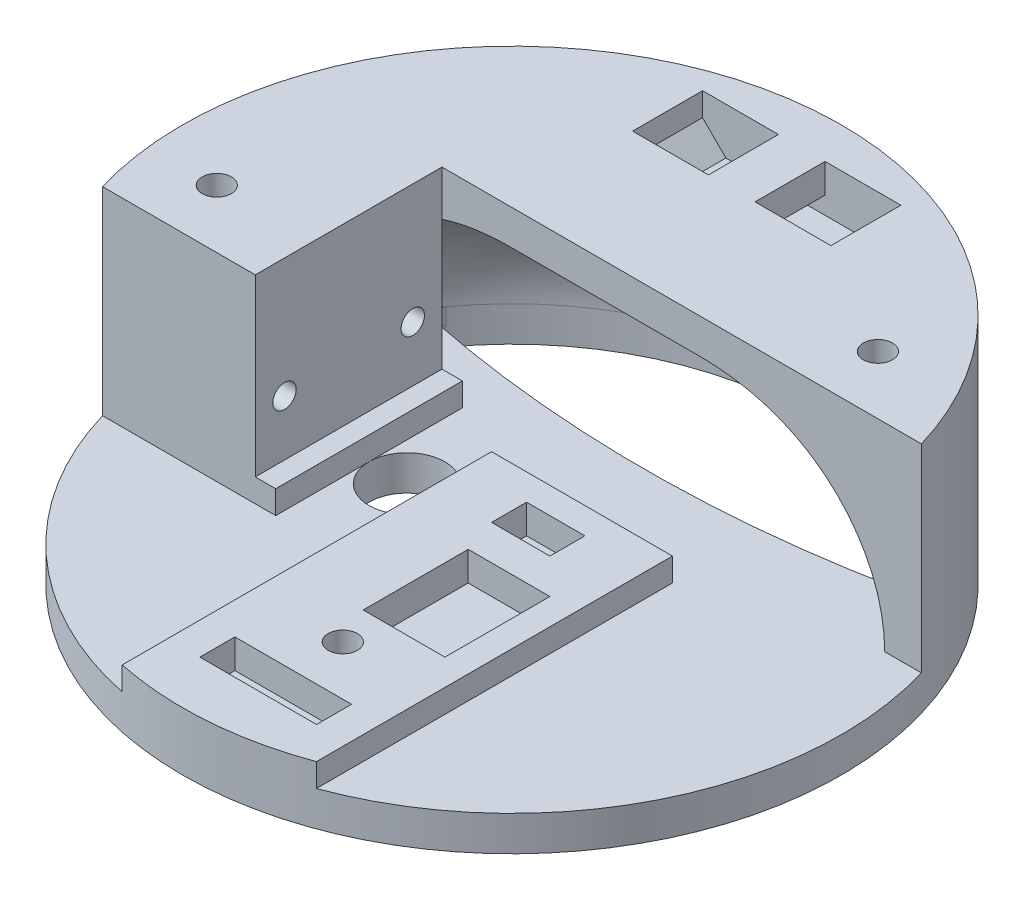
from build123d import *
from build123d.topology import SkipClean

# Parameters (mm, degrees)
SKETCH1_R               = 28.25
BOSS_EXTRUDE1_DEPTH     = 3
SKETCH2_R               = 3.25
CUT_EXTRUDE1_DEPTH      = 41.064011282
CUT_EXTRUDE2_DEPTH      = 41.064011282
REVOLVE1_ANGLE          = 180
BOSS_EXTRUDE2_DEPTH     = 17
CHAMFER2_SIZE           = 2
CUT_EXTRUDE5_DEPTH      = 54.275815376
CUT_EXTRUDE5_DEPTH_BACK = 1.75
SKETCH9_W               = 16
SKETCH9_H               = 15
CUT_EXTRUDE11_REACH     = 45.418
BOSS_EXTRUDE6_START     = -3
BOSS_EXTRUDE6_DEPTH     = 3
SKETCH17_R              = 1
CUT_EXTRUDE12_DEPTH     = 6
BOSS_EXTRUDE5_DEPTH     = 2
SKETCH13_R              = 1.25
CUT_EXTRUDE8_DEPTH      = 4
SKETCH14_W              = 10
SKETCH14_H              = 3
SKETCH14_W_2            = 5
SKETCH14_W_3            = 7
SKETCH14_H_2            = 9
CUT_EXTRUDE9_DEPTH      = 2.5
FILLET40_R              = 1
SKETCH18_R              = 1.25
CUT_EXTRUDE13_DEPTH     = 5
SKETCH19_W              = 6.5
SKETCH19_H              = 6
CUT_EXTRUDE14_DEPTH     = 4
SKETCH20_W              = 6
SKETCH20_H              = 1.5
CUT_EXTRUDE15_DEPTH     = 4
CHAMFER3_SIZE           = 2


# Read off the part's stored shape, not the designer's step: Revolve1
with BuildPart() as part:
    # Sketch1 → Boss-Extrude1 (new body)
    with BuildSketch(Plane(origin=(0, 0, 0), x_dir=(1, 0, 0), z_dir=(0, 1, 0))):
        with Locations(Location((0, 0, 0), (0, 0, 270))):
            Circle(SKETCH1_R)
    extrude(amount=BOSS_EXTRUDE1_DEPTH)

    # Sketch2 → Cut-Extrude1 (cut, through all)
    with BuildSketch(Plane(origin=(0, 3, 0), x_dir=(1, 0, 0), z_dir=(0, 1, 0))):
        with Locations(Location((-9, 0, 0), (0, 0, 270))):
            Circle(SKETCH2_R)
    extrude(amount=-CUT_EXTRUDE1_DEPTH, mode=Mode.SUBTRACT)

    # Sketch3 → Cut-Extrude2 (cut, through all)
    with BuildSketch(Plane(origin=(0, 3, 0), x_dir=(1, 0, 0), z_dir=(0, 1, 0))):
        with BuildLine():
            ThreePointArc((21.3084804, 13.546629213), (0, 25.25), (-21.3084804, 13.546629213))
            ThreePointArc((-21.3084804, 13.546629213), (0, 11.25), (21.3084804, 13.546629213))
        make_face()
    extrude(amount=-CUT_EXTRUDE2_DEPTH, mode=Mode.SUBTRACT)

    # Revolve1 outline → Revolve1 (revolve)
    with SkipClean():  # the faces are left unmerged after this step: merging them gives an invalid solid
        with BuildSketch(Plane.XY):
            with BuildLine():
                Line((28.25, 3), (28.25, 20))
                Line((28.25, 20), (11.25, 20))
                Line((11.25, 20), (11.25, 17))
                ThreePointArc((11.25, 17), (21.149494937, 12.899494937), (25.25, 3))
                Line((25.25, 3), (28.25, 3))
            make_face()
        revolve(axis=Axis((0, 0, 0), (0, 1, 0)), revolution_arc=REVOLVE1_ANGLE)
    add(part.part.scale(1), mode=Mode.REPLACE)  # the faces are merged on a copy

    # Sketch5 → Boss-Extrude2 (add)
    with BuildSketch(Plane(origin=(0, 3, 0), x_dir=(1, 0, 0), z_dir=(0, 1, 0))):
        with BuildLine():
            Line((-27.093587802, 8), (-12.25, 8))
            Line((-12.25, 8), (-12.25, -8))
            Line((-12.25, -8), (-27.093587802, -8))
            ThreePointArc((-27.093587802, -8), (-27.959402313, -4.041574234), (-28.25, 0))
            ThreePointArc((-28.25, 0), (-27.959402313, 4.041574234), (-27.093587802, 8))
        make_face()
    extrude(amount=BOSS_EXTRUDE2_DEPTH)

    # Chamfer2
    chamfer2_edges = [part.edges().sort_by_distance(p)[0] for p in [
        (0, 0, -11.25),
    ]]
    chamfer(chamfer2_edges, length=CHAMFER2_SIZE)

    # Sketch9 → Cut-Extrude5 (cut, two sides: drawn at the far end of the back side and taken through both)
    with BuildSketch(Plane(origin=(-12.25, 0, 0), x_dir=(0, 0, -1), z_dir=(1, 0, 0)).offset(-CUT_EXTRUDE5_DEPTH_BACK)):
        with Locations((0, 12.5)):
            Rectangle(SKETCH9_W, SKETCH9_H)
    extrude(amount=CUT_EXTRUDE5_DEPTH + CUT_EXTRUDE5_DEPTH_BACK, mode=Mode.SUBTRACT)

    # Sketch15 → Cut-Extrude11 (cut, up to next)
    with BuildSketch(Plane(origin=(0, 3, 0), x_dir=(1, 0, 0), z_dir=(0, 1, 0)), mode=Mode.PRIVATE) as cut_extrude11_sk1:
        with BuildLine():
            Line((25.106406461, 0), (28.25, 0))
            ThreePointArc((28.25, 0), (27.959402313, 4.041574234), (27.093587802, 8))
            Line((27.093587802, 8), (23.797723533, 8))
            ThreePointArc((23.797723533, 8), (24.777075748, 4.053167003), (25.106406461, 0))
        make_face()
    cut_extrude11_tool1 = extrude(cut_extrude11_sk1.sketch, amount=CUT_EXTRUDE11_REACH, mode=Mode.PRIVATE) & part.part
    add(cut_extrude11_tool1.solids().sort_by_distance((26.266134, 3, -4.03133))[0], mode=Mode.SUBTRACT)

    # Sketch16 → Boss-Extrude6 (add)
    with BuildSketch(Plane(origin=(0, 20, 0), x_dir=(1, 0, 0), z_dir=(0, 1, 0)).offset(BOSS_EXTRUDE6_START)):
        with BuildLine():
            Line((-7.90964601, 8), (7.90964601, 8))
            ThreePointArc((7.90964601, 8), (0, 11.25), (-7.90964601, 8))
        make_face()
    extrude(amount=BOSS_EXTRUDE6_DEPTH)

    # Sketch17 → Cut-Extrude12 (cut)
    with BuildSketch(Plane(origin=(-14, 0, 0), x_dir=(0, 0, -1), z_dir=(1, 0, 0))):
        with Locations((-5.5, 9.75)):
            Circle(SKETCH17_R)
        with Locations(Location((5.5, 9.75, 0), (0, 0, 180))):
            Circle(SKETCH17_R)
    extrude(amount=-CUT_EXTRUDE12_DEPTH, mode=Mode.SUBTRACT)

    # Sketch12 → Boss-Extrude5 (add)
    with BuildSketch(Plane(origin=(0, 3, 0), x_dir=(1, 0, 0), z_dir=(0, 1, 0))):
        with BuildLine():
            Line((-5.75, 4), (9.75, 4))
            Line((9.75, 4), (9.75, -26.514147167))
            ThreePointArc((9.75, -26.514147167), (2.080255313, -28.173303637), (-5.75, -27.658633372))
            Line((-5.75, -27.658633372), (-5.75, 4))
        make_face()
    extrude(amount=BOSS_EXTRUDE5_DEPTH)

    # Sketch13 → Cut-Extrude8 (cut)
    with BuildSketch(Plane(origin=(0, 5, 0), x_dir=(1, 0, 0), z_dir=(0, 1, 0))):
        with Locations(Location((2, -16.5, 0), (0, 0, 270))):
            Circle(SKETCH13_R)
    extrude(amount=-CUT_EXTRUDE8_DEPTH, mode=Mode.SUBTRACT)

    # Sketch14 → Cut-Extrude9 (cut)
    with BuildSketch(Plane(origin=(0, 5, 0), x_dir=(1, 0, 0), z_dir=(0, 1, 0))):
        with Locations((2, -22.25)):
            Rectangle(SKETCH14_W, SKETCH14_H)
        with Locations((2, 0.25)):
            Rectangle(SKETCH14_W_2, SKETCH14_H)
        with Locations((4, -8.75)):
            Rectangle(SKETCH14_W_3, SKETCH14_H_2)
    extrude(amount=-CUT_EXTRUDE9_DEPTH, mode=Mode.SUBTRACT)

    # Fillet40
    fillet40_edges = [part.edges().sort_by_distance(p)[0] for p in [
        (21.3084804, 2.5, -13.546629213),
        (-21.3084804, 2.5, -13.546629213),
        (21.854641388, 1.003709428, -12.646626025),
        (-21.854641386, 1.003709427, -12.646626025),
    ]]
    fillet(fillet40_edges, radius=FILLET40_R)

    # Sketch18 → Cut-Extrude13 (cut)
    with BuildSketch(Plane(origin=(0, 20, 0), x_dir=(1, 0, 0), z_dir=(0, 1, 0))):
        with Locations(Location((-22.299103121, -3, 0), (0, 0, 270))):
            Circle(SKETCH18_R)
        with Locations(Location((18.364367672, 13, 0), (0, 0, 270))):
            Circle(SKETCH18_R)
    extrude(amount=-CUT_EXTRUDE13_DEPTH, mode=Mode.SUBTRACT)

    # Sketch19 → Cut-Extrude14 (cut)
    with BuildSketch(Plane(origin=(0, 20, 0), x_dir=(1, 0, 0), z_dir=(0, 1, 0))):
        with Locations((-5.25, 21.835710177)):
            Rectangle(SKETCH19_W, SKETCH19_H)
        with Locations((5.25, 21.835710177)):
            Rectangle(SKETCH19_W, SKETCH19_H)
    extrude(amount=-CUT_EXTRUDE14_DEPTH, mode=Mode.SUBTRACT)

    # Sketch20 → Cut-Extrude15 (cut)
    with BuildSketch(Plane(origin=(2, 0, 0), x_dir=(0, 0, -1), z_dir=(1, 0, 0))):
        with Locations((21.835710177, 16.75)):
            Rectangle(SKETCH20_W, SKETCH20_H)
    extrude(amount=-CUT_EXTRUDE15_DEPTH, mode=Mode.SUBTRACT)

    # Chamfer3
    chamfer3_edges = [part.edges().sort_by_distance(p)[0] for p in [
        (-8.5, 16, -21.835710177),
        (8.5, 16, -21.835710177),
    ]]
    chamfer(chamfer3_edges, length=CHAMFER3_SIZE)


solid = part.part
